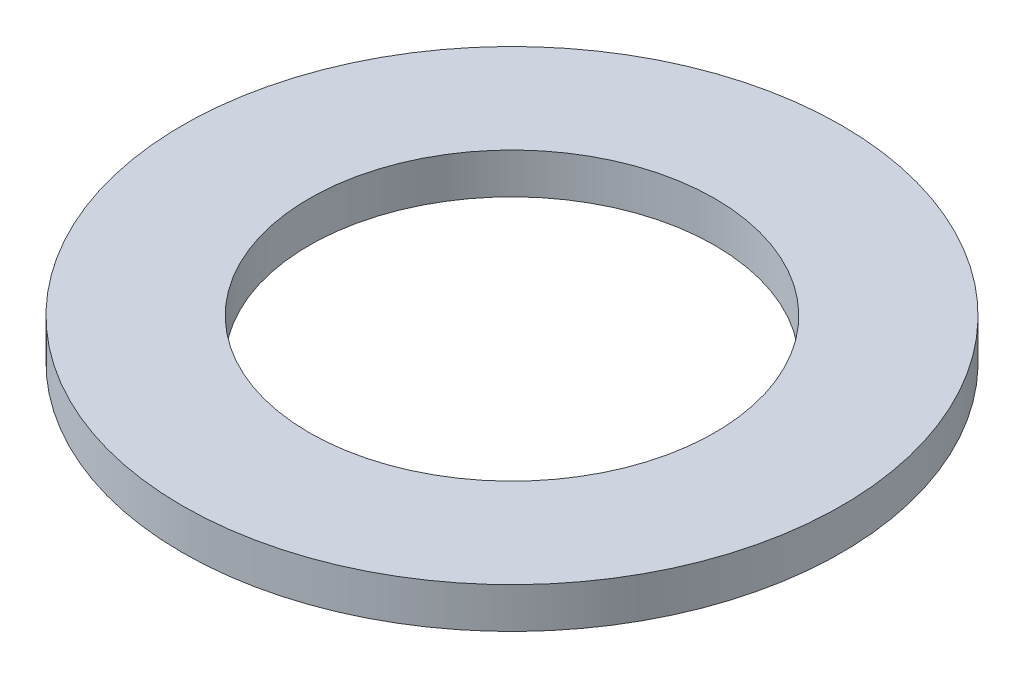
from build123d import *

# Parameters (mm, degrees)
SKETCH1_R           = 32.5
BOSS_EXTRUDE1_DEPTH = 4
SKETCH2_R           = 20
CUT_EXTRUDE1_DEPTH  = 47.135669498


with BuildPart() as part:
    # Sketch1 → Boss-Extrude1 (new body)
    with BuildSketch(Plane(origin=(0, 0, 0), x_dir=(1, 0, 0), z_dir=(0, 1, 0))):
        Circle(SKETCH1_R)
    extrude(amount=BOSS_EXTRUDE1_DEPTH)

    # Sketch2 → Cut-Extrude1 (cut, through all)
    with BuildSketch(Plane(origin=(0, 0, 0), x_dir=(1, 0, 0), z_dir=(0, 1, 0))):
        Circle(SKETCH2_R)
    extrude(amount=CUT_EXTRUDE1_DEPTH, mode=Mode.SUBTRACT)


solid = part.part
